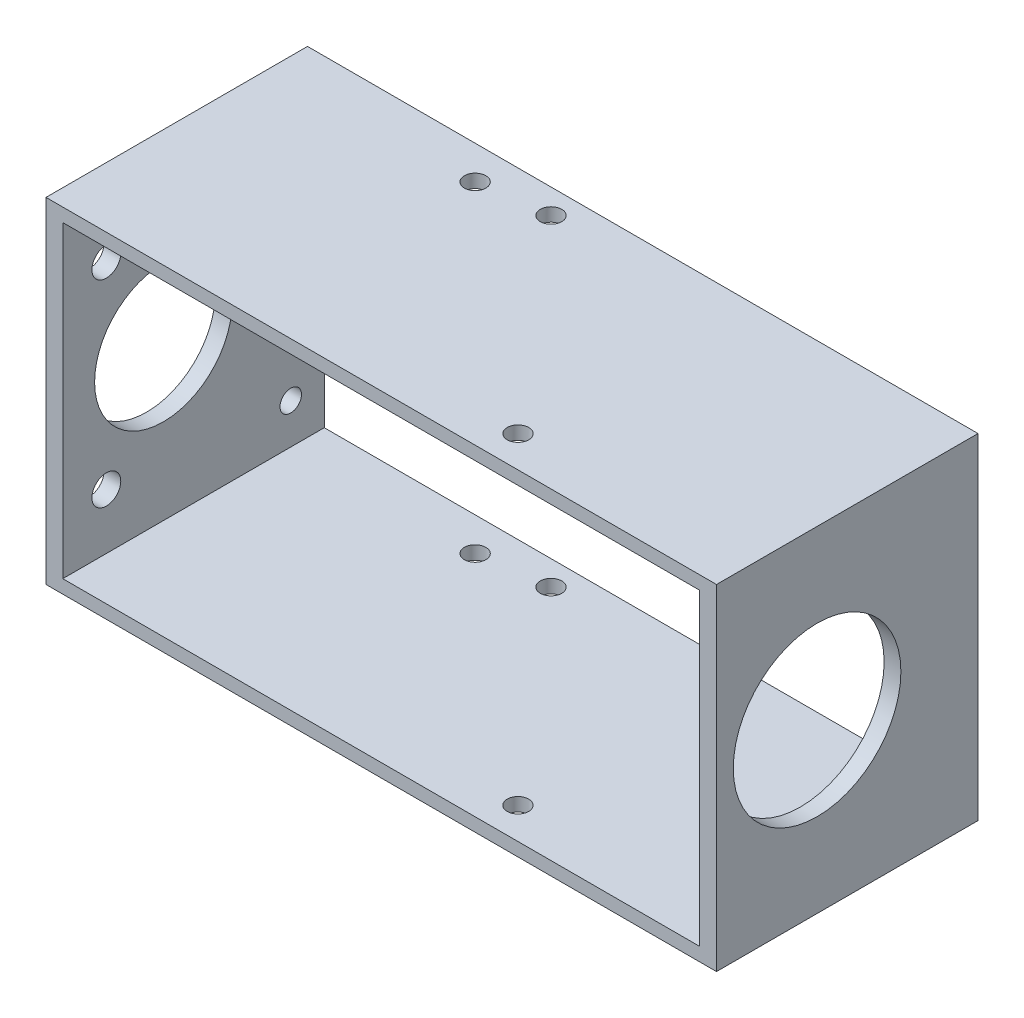
from build123d import *

# Parameters (mm, degrees)
SKETCH_1_W          = 100
SKETCH_1_H          = 50
SKETCH_1_W_2        = 95
SKETCH_1_H_2        = 46
EXTRUDE_1_DEPTH     = 19.5
SKETCH_2_R          = 1.6
CUT_EXTRUDE_1_DEPTH = 74.350187457
CUT_EXTRUDE_2_REACH = 106.906
SKETCH_3_R          = 10.25
SKETCH_3_R_2        = 2.15
SKETCH_3_R_3        = 1.6
CUT_EXTRUDE_3_REACH = 106.906
SKETCH_4_R          = 12.5


with BuildPart() as part:
    # ｽｹｯﾁ1 → ﾎﾞｽ - 押し出し1 (new, symmetric)
    with BuildSketch(Plane.XY):
        Rectangle(SKETCH_1_W, SKETCH_1_H)
        Rectangle(SKETCH_1_W_2, SKETCH_1_H_2, mode=Mode.SUBTRACT)
    extrude(amount=EXTRUDE_1_DEPTH, both=True)

    # ｽｹｯﾁ2 → ｶｯﾄ - 押し出し1 (cut, through all)
    with BuildSketch(Plane(origin=(0, 25, 0), x_dir=(1, 0, 0), z_dir=(0, 1, 0))):
        with Locations((-10, 15.820888862)):
            Circle(SKETCH_2_R)
        with Locations((15.711504387, -14.820888862)):
            Circle(SKETCH_2_R)
        with Locations((-20, 14.5)):
            Circle(SKETCH_2_R)
    extrude(amount=-CUT_EXTRUDE_1_DEPTH, mode=Mode.SUBTRACT)

    # ｽｹｯﾁ3 → ｶｯﾄ - 押し出し2 (cut, up to next)
    with BuildSketch(Plane.ZY.offset(50), mode=Mode.PRIVATE) as cut_extrude_2_sk1:
        with Locations((4.5, 0)):
            Circle(SKETCH_3_R)
    cut_extrude_2_tool1 = extrude(cut_extrude_2_sk1.sketch, amount=-CUT_EXTRUDE_2_REACH, mode=Mode.PRIVATE) & part.part
    # ｽｹｯﾁ3 → ｶｯﾄ - 押し出し2 (cut, up to next)
    with BuildSketch(Plane.ZY.offset(50), mode=Mode.PRIVATE) as cut_extrude_2_sk2:
        with Locations((-12.5, 0)):
            Circle(SKETCH_3_R_2)
    cut_extrude_2_tool2 = extrude(cut_extrude_2_sk2.sketch, amount=-CUT_EXTRUDE_2_REACH, mode=Mode.PRIVATE) & part.part
    # ｽｹｯﾁ3 → ｶｯﾄ - 押し出し2 (cut, up to next)
    with BuildSketch(Plane.ZY.offset(50), mode=Mode.PRIVATE) as cut_extrude_2_sk3:
        with Locations((13, 14.722431864)):
            Circle(SKETCH_3_R_2)
    cut_extrude_2_tool3 = extrude(cut_extrude_2_sk3.sketch, amount=-CUT_EXTRUDE_2_REACH, mode=Mode.PRIVATE) & part.part
    # ｽｹｯﾁ3 → ｶｯﾄ - 押し出し2 (cut, up to next)
    with BuildSketch(Plane.ZY.offset(50), mode=Mode.PRIVATE) as cut_extrude_2_sk4:
        with Locations((13, -14.722431864)):
            Circle(SKETCH_3_R_2)
    cut_extrude_2_tool4 = extrude(cut_extrude_2_sk4.sketch, amount=-CUT_EXTRUDE_2_REACH, mode=Mode.PRIVATE) & part.part
    # ｽｹｯﾁ3 → ｶｯﾄ - 押し出し2 (cut, up to next)
    with BuildSketch(Plane.ZY.offset(50), mode=Mode.PRIVATE) as cut_extrude_2_sk5:
        with Locations((-14.5, -17)):
            Circle(SKETCH_3_R_3)
    cut_extrude_2_tool5 = extrude(cut_extrude_2_sk5.sketch, amount=-CUT_EXTRUDE_2_REACH, mode=Mode.PRIVATE) & part.part
    # ｽｹｯﾁ3 → ｶｯﾄ - 押し出し2 (cut, up to next)
    with BuildSketch(Plane.ZY.offset(50), mode=Mode.PRIVATE) as cut_extrude_2_sk6:
        with Locations((-14.5, 17)):
            Circle(SKETCH_3_R_3)
    cut_extrude_2_tool6 = extrude(cut_extrude_2_sk6.sketch, amount=-CUT_EXTRUDE_2_REACH, mode=Mode.PRIVATE) & part.part
    add(cut_extrude_2_tool1.solids().sort_by_distance((-50, 0, 4.5))[0], mode=Mode.SUBTRACT)
    add(cut_extrude_2_tool2.solids().sort_by_distance((-50, 0, -12.5))[0], mode=Mode.SUBTRACT)
    add(cut_extrude_2_tool3.solids().sort_by_distance((-50, 14.722432, 13))[0], mode=Mode.SUBTRACT)
    add(cut_extrude_2_tool4.solids().sort_by_distance((-50, -14.722432, 13))[0], mode=Mode.SUBTRACT)
    add(cut_extrude_2_tool5.solids().sort_by_distance((-50, -17, -14.5))[0], mode=Mode.SUBTRACT)
    add(cut_extrude_2_tool6.solids().sort_by_distance((-50, 17, -14.5))[0], mode=Mode.SUBTRACT)

    # ｽｹｯﾁ4 → ｶｯﾄ - 押し出し3 (cut, up to next)
    with BuildSketch(Plane(origin=(50, 0, 0), x_dir=(0, 0, -1), z_dir=(1, 0, 0)), mode=Mode.PRIVATE) as cut_extrude_3_sk1:
        with Locations((-4.5, 0)):
            Circle(SKETCH_4_R)
    cut_extrude_3_tool1 = extrude(cut_extrude_3_sk1.sketch, amount=-CUT_EXTRUDE_3_REACH, mode=Mode.PRIVATE) & part.part
    add(cut_extrude_3_tool1.solids().sort_by_distance((50, 0, 4.5))[0], mode=Mode.SUBTRACT)


solid = part.part
